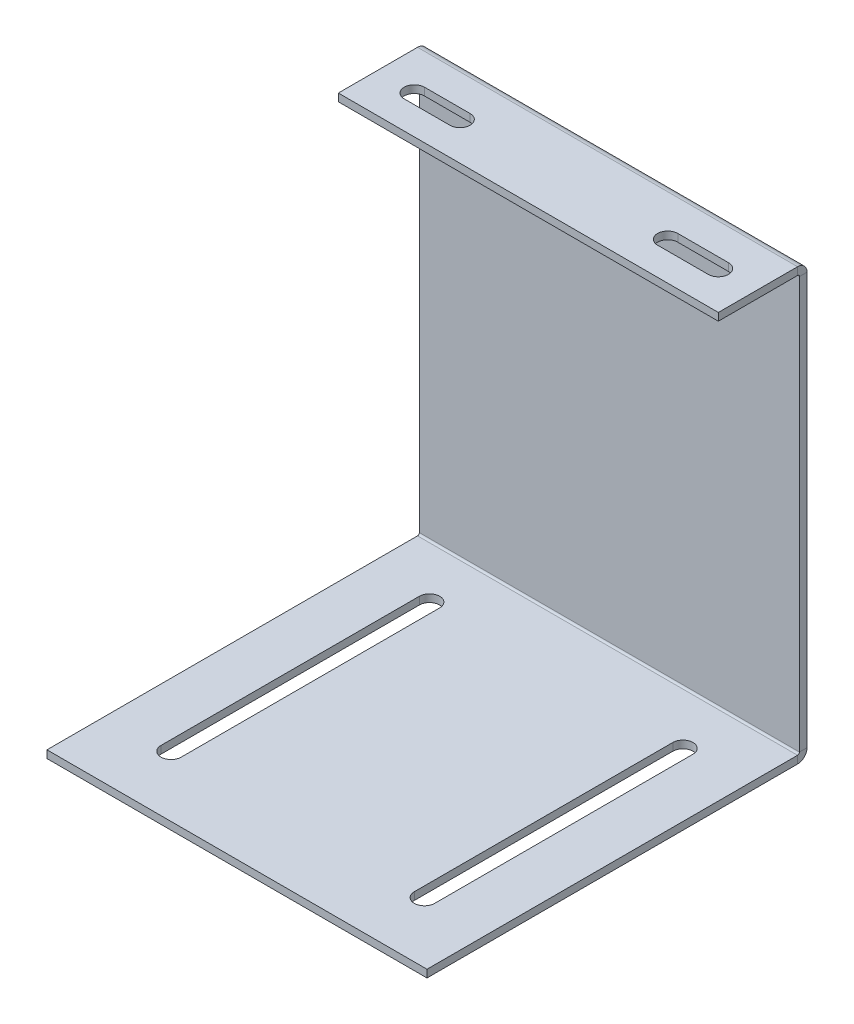
from build123d import *

# Parameters (mm, degrees)
SKETCH1_W                    = 150
SKETCH1_H                    = 150
BASE_FLANGE1_DEPTH           = 3
EDGE_FLANGE1_STRIP_W         = 13.4732
EDGE_FLANGE1_STRIP_H         = 3
EDGE_FLANGE1_STRIP_CUT_DEPTH = 150
EDGE_FLANGE1_DEPTH           = 150
EDGE_FLANGE2_STRIP_W         = 13.4732
EDGE_FLANGE2_STRIP_H         = 3
EDGE_FLANGE2_STRIP_CUT_DEPTH = 150
EDGE_FLANGE2_DEPTH           = 150
CUT_EXTRUDE1_DEPTH           = 10


# Sheet-metal steps are written as plain solids
with BuildPart() as part:
    # Sketch1 → Base-Flange1 (new body)
    with BuildSketch(Plane(origin=(0, 0, 0), x_dir=(1, 0, 0), z_dir=(0, 1, 0))):
        with Locations((-55.705035971, -46.04676259)):
            Rectangle(SKETCH1_W, SKETCH1_H)
        with BuildLine():
            Line((-101.705035971, 4.95323741), (-101.705035971, -97.04676259))
            ThreePointArc((-101.705035971, -97.04676259), (-105.705035971, -101.04676259), (-109.705035971, -97.04676259))
            Line((-109.705035971, -97.04676259), (-109.705035971, 4.95323741))
            ThreePointArc((-109.705035971, 4.95323741), (-105.705035971, 8.95323741), (-101.705035971, 4.95323741))
        make_face(mode=Mode.SUBTRACT)
        with BuildLine():
            Line((-1.705035971, 4.95323741), (-1.705035971, -97.04676259))
            ThreePointArc((-1.705035971, -97.04676259), (-5.705035971, -101.04676259), (-9.705035971, -97.04676259))
            Line((-9.705035971, -97.04676259), (-9.705035971, 4.95323741))
            ThreePointArc((-9.705035971, 4.95323741), (-5.705035971, 8.95323741), (-1.705035971, 4.95323741))
        make_face(mode=Mode.SUBTRACT)
    extrude(amount=-BASE_FLANGE1_DEPTH)

    # Edge-Flange1 strip (across the edge) → Edge-Flange1 strip cut (cut)
    with BuildSketch(Plane(origin=(19.294964029, 0, -28.95323741), x_dir=(0, 0, 1), z_dir=(-1, 0, 0))):
        with Locations((-3, -1.5)):
            Rectangle(EDGE_FLANGE1_STRIP_W, EDGE_FLANGE1_STRIP_H)
    extrude(amount=EDGE_FLANGE1_STRIP_CUT_DEPTH, mode=Mode.SUBTRACT)

    # Edge-Flange1 section (across the edge) → Edge-Flange1 (add)
    with BuildSketch(Plane(origin=(19.294964029, 0, -28.95323741), x_dir=(0, 0, 1), z_dir=(-1, 0, 0))):
        with BuildLine():
            Line((0, 0.7366), (0, 167))
            Line((0, 167), (3, 167))
            Line((3, 167), (3, 0.7366))
            ThreePointArc((3, 0.7366), (3.215745145, 0.215745145), (3.7366, 0))
            Line((3.7366, 0), (3.7366, -3))
            ThreePointArc((3.7366, -3), (1.094424801, -1.905575199), (0, 0.7366))
        make_face()
    extrude(amount=EDGE_FLANGE1_DEPTH)

    # Edge-Flange2 strip (across the edge) → Edge-Flange2 strip cut (cut)
    with BuildSketch(Plane(origin=(19.294964029, 167, -25.95323741), x_dir=(0, -1, 0), z_dir=(-1, 0, 0))):
        with Locations((-3, -1.5)):
            Rectangle(EDGE_FLANGE2_STRIP_W, EDGE_FLANGE2_STRIP_H)
    extrude(amount=EDGE_FLANGE2_STRIP_CUT_DEPTH, mode=Mode.SUBTRACT)

    # Edge-Flange2 section (across the edge) → Edge-Flange2 (add)
    with BuildSketch(Plane(origin=(19.294964029, 167, -25.95323741), x_dir=(0, -1, 0), z_dir=(-1, 0, 0))):
        with BuildLine():
            Line((0, 0.7366), (0, 32))
            Line((0, 32), (3, 32))
            Line((3, 32), (3, 0.7366))
            ThreePointArc((3, 0.7366), (3.215745145, 0.215745145), (3.7366, 0))
            Line((3.7366, 0), (3.7366, -3))
            ThreePointArc((3.7366, -3), (1.094424801, -1.905575199), (0, 0.7366))
        make_face()
    extrude(amount=EDGE_FLANGE2_DEPTH)

    # Sketch12 → Cut-Extrude1 (cut)
    with BuildSketch(Plane(origin=(0, 167, 0), x_dir=(1, 0, 0), z_dir=(0, 1, 0))):
        with BuildLine():
            Line((4.294964029, 4.95323741), (-15.705035971, 4.95323741))
            ThreePointArc((-15.705035971, 4.95323741), (-19.705035971, 8.95323741), (-15.705035971, 12.95323741))
            Line((-15.705035971, 12.95323741), (4.294964029, 12.95323741))
            ThreePointArc((4.294964029, 12.95323741), (8.294964029, 8.95323741), (4.294964029, 4.95323741))
        make_face()
        with BuildLine():
            Line((-115.705035971, 4.95323741), (-97.680274897, 4.95323741))
            ThreePointArc((-97.680274897, 4.95323741), (-93.680274897, 8.95323741), (-97.680274897, 12.95323741))
            Line((-97.680274897, 12.95323741), (-115.705035971, 12.95323741))
            ThreePointArc((-115.705035971, 12.95323741), (-119.705035971, 8.95323741), (-115.705035971, 4.95323741))
        make_face()
    extrude(amount=-CUT_EXTRUDE1_DEPTH, mode=Mode.SUBTRACT)


solid = part.part
